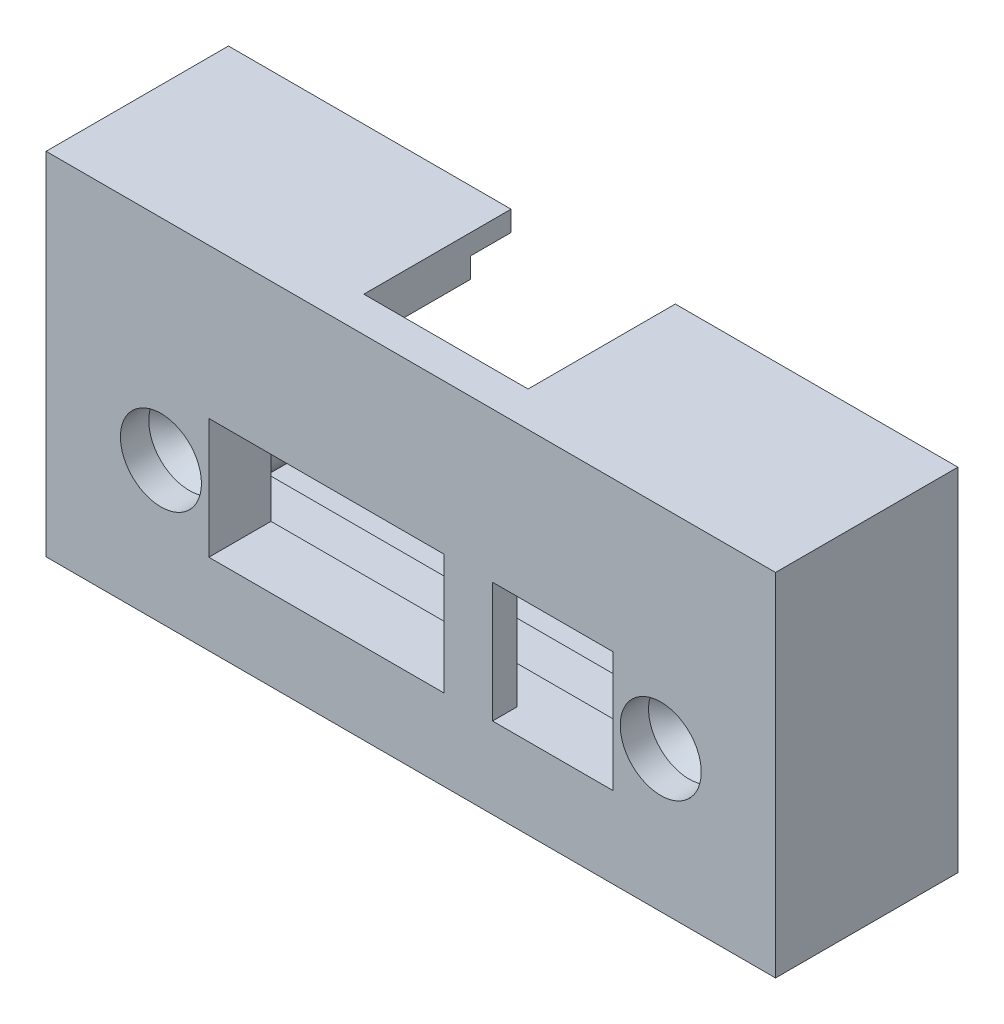
from build123d import *

# Parameters (mm, degrees)
SKETCH1_W           = 54
SKETCH1_H           = 26
SKETCH1_W_2         = 29.9
SKETCH1_H_2         = 8.9
BOSS_EXTRUDE1_DEPTH = 4.6
SKETCH2_W           = 3.6
SKETCH2_H           = 8.9
BOSS_EXTRUDE2_DEPTH = 1.8
SKETCH3_R           = 3.45
BOSS_EXTRUDE3_DEPTH = 7.4
SKETCH4_W           = 54
SKETCH4_H           = 26
SKETCH4_W_2         = 48
SKETCH4_H_2         = 20
BOSS_EXTRUDE4_DEPTH = 8.9
SKETCH5_W           = 51
SKETCH5_H           = 23
SKETCH5_W_2         = 48
SKETCH5_H_2         = 20
CUT_EXTRUDE1_DEPTH  = 3
SKETCH6_R           = 1.6
CUT_EXTRUDE2_DEPTH  = 12
CUT_EXTRUDE3_REACH  = 40.525
SKETCH7_W           = 12.16
SKETCH7_H           = 10.9
SKETCH8_R           = 3
CUT_EXTRUDE4_DEPTH  = 34.401384702
CHAMFER1_SIZE       = 1.5


with BuildPart() as part:
    # Sketch1 → Boss-Extrude1 (new body)
    with BuildSketch(Plane.XY):
        with Locations((0, -2.95)):
            Rectangle(SKETCH1_W, SKETCH1_H)
        with Locations((0, -5.5)):
            Rectangle(SKETCH1_W_2, SKETCH1_H_2, mode=Mode.SUBTRACT)
    extrude(amount=BOSS_EXTRUDE1_DEPTH)

    # Sketch2 → Boss-Extrude2 (add)
    with BuildSketch(Plane.XY.offset(4.6)):
        with Locations((4.25, -5.5)):
            Rectangle(SKETCH2_W, SKETCH2_H)
    extrude(amount=-BOSS_EXTRUDE2_DEPTH)

    # Sketch3 → Boss-Extrude3 (add)
    with BuildSketch(Plane(origin=(0, 0, 0), x_dir=(-1, 0, 0), z_dir=(0, 0, -1))):
        with Locations(Location((-18.5, -5.5, 0), (0, 0, 270))):
            Circle(SKETCH3_R)
        with Locations(Location((18.5, -5.5, 0), (0, 0, 270))):
            Circle(SKETCH3_R)
    extrude(amount=BOSS_EXTRUDE3_DEPTH)

    # Sketch4 → Boss-Extrude4 (add)
    with BuildSketch(Plane(origin=(0, 0, 0), x_dir=(-1, 0, 0), z_dir=(0, 0, -1))):
        with Locations((0, -2.95)):
            Rectangle(SKETCH4_W, SKETCH4_H)
        with Locations((0, -2.95)):
            Rectangle(SKETCH4_W_2, SKETCH4_H_2, mode=Mode.SUBTRACT)
    extrude(amount=BOSS_EXTRUDE4_DEPTH)

    # Sketch5 → Cut-Extrude1 (cut)
    with BuildSketch(Plane(origin=(0, 0, -8.9), x_dir=(-1, 0, 0), z_dir=(0, 0, -1))):
        with Locations((0, -2.95)):
            Rectangle(SKETCH5_W, SKETCH5_H)
        with Locations((0, -2.95)):
            Rectangle(SKETCH5_W_2, SKETCH5_H_2, mode=Mode.SUBTRACT)
    extrude(amount=-CUT_EXTRUDE1_DEPTH, mode=Mode.SUBTRACT)

    # Sketch6 → Cut-Extrude2 (cut)
    with BuildSketch(Plane(origin=(0, 0, -7.4), x_dir=(-1, 0, 0), z_dir=(0, 0, -1))):
        with Locations(Location((-18.5, -5.5, 0), (0, 0, 90))):
            Circle(SKETCH6_R)
        with Locations(Location((18.5, -5.5, 0), (0, 0, 90))):
            Circle(SKETCH6_R)
    extrude(amount=-CUT_EXTRUDE2_DEPTH, mode=Mode.SUBTRACT)

    # Cut-Extrude3: up to this face of the body (flat: up to its plane)
    cut_extrude3_end = Plane(part.part.faces().sort_by_distance((0, 7.05, -2.95))[0])
    # Sketch7 → Cut-Extrude3 (cut, up to the picked face)
    with BuildSketch(Plane(origin=(0, 10.05, 0), x_dir=(1, 0, 0), z_dir=(0, 1, 0)), mode=Mode.PRIVATE) as cut_extrude3_sk1:
        with Locations((0, 3.45)):
            Rectangle(SKETCH7_W, SKETCH7_H)
    cut_extrude3_tool1 = split(extrude(cut_extrude3_sk1.sketch, amount=-CUT_EXTRUDE3_REACH, mode=Mode.PRIVATE), bisect_by=cut_extrude3_end, keep=Keep.BOTH, mode=Mode.PRIVATE)
    add(cut_extrude3_tool1.solids().sort_by(Axis((0, 10.05, -3.45), (0, -1, 0)))[0], mode=Mode.SUBTRACT)

    # Sketch8 → Cut-Extrude4 (cut, through all)
    with BuildSketch(Plane.XY.offset(2.6)):
        with Locations((-18.5, -5.5)):
            Circle(SKETCH8_R)
        with Locations((18.5, -5.5)):
            Circle(SKETCH8_R)
    extrude(amount=CUT_EXTRUDE4_DEPTH, mode=Mode.SUBTRACT)

    # Chamfer1
    # the kernel refuses this chamfer: 1.5 mm, written as the material it takes off along each edge
    with BuildSketch(Plane(origin=(-18.5, -5.5, 2.6), x_dir=(0, 1, 0), z_dir=(-1, 0, 0))) as chamfer1_piece_1_section:
        Polygon((1.6 + CHAMFER1_SIZE, 0), (1.6, CHAMFER1_SIZE), (1.6, 0), align=None)
    chamfer1_piece_1 = revolve(axis=Axis((-18.5, -5.5, 2.6), (0, 0, -1)), mode=Mode.PRIVATE)
    chamfer1_piece_1 = chamfer1_piece_1 & Plane(origin=(-18.5, -5.5, 1.79661682), x_dir=(1, 0, 0), z_dir=(0, 0, -1)) * Cylinder(3, 13, mode=Mode.PRIVATE)
    add(chamfer1_piece_1, mode=Mode.SUBTRACT)
    with BuildSketch(Plane(origin=(18.5, -5.5, 2.6), x_dir=(0, 1, 0), z_dir=(-1, 0, 0))) as chamfer1_piece_2_section:
        Polygon((1.6 + CHAMFER1_SIZE, 0), (1.6, CHAMFER1_SIZE), (1.6, 0), align=None)
    chamfer1_piece_2 = revolve(axis=Axis((18.5, -5.5, 2.6), (0, 0, -1)), mode=Mode.PRIVATE)
    chamfer1_piece_2 = chamfer1_piece_2 & Plane(origin=(18.5, -5.5, 1.79661682), x_dir=(1, 0, 0), z_dir=(0, 0, -1)) * Cylinder(3, 13, mode=Mode.PRIVATE)
    add(chamfer1_piece_2, mode=Mode.SUBTRACT)


solid = part.part
